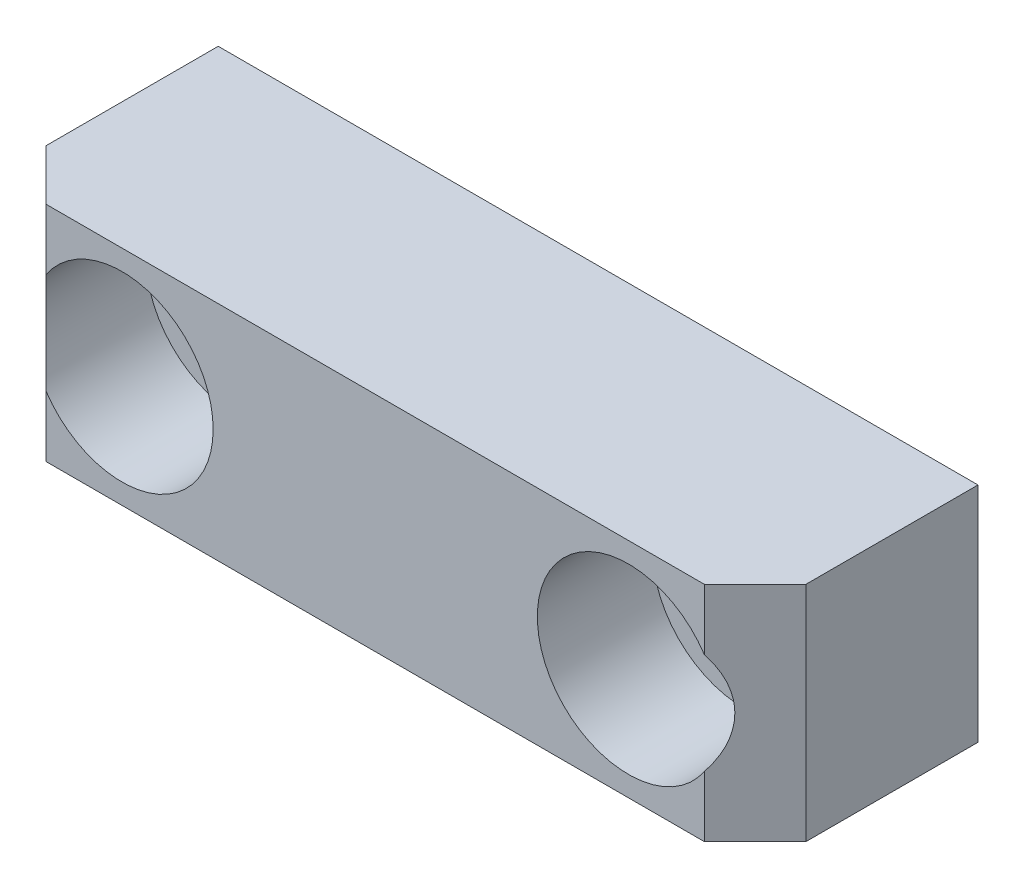
from build123d import *

# Parameters (mm, degrees)
SKETCH1_W                                        = 75
SKETCH1_H                                        = 22
BOSS_EXTRUDE1_DEPTH                              = 22
CBORE_FOR_M10_SOCKET_HEAD_CAP_SCREW1_D           = 12
CBORE_FOR_M10_SOCKET_HEAD_CAP_SCREW1_CBORE_D     = 18
CBORE_FOR_M10_SOCKET_HEAD_CAP_SCREW1_CBORE_DEPTH = 11.366
CHAMFER1_SIZE                                    = 5


with BuildPart() as part:
    # Sketch1 → Boss-Extrude1 (new body)
    with BuildSketch(Plane(origin=(0, 0, 0), x_dir=(1, 0, 0), z_dir=(0, 1, 0))):
        with Locations((0, 11)):
            Rectangle(SKETCH1_W, SKETCH1_H)
    extrude(amount=BOSS_EXTRUDE1_DEPTH)

    # CBORE for M10 Socket Head Cap Screw1 (through all)
    with Locations(Plane.XY):
        with Locations((25, 11), (-25, 11)):
            CounterBoreHole(CBORE_FOR_M10_SOCKET_HEAD_CAP_SCREW1_D / 2, CBORE_FOR_M10_SOCKET_HEAD_CAP_SCREW1_CBORE_D / 2, CBORE_FOR_M10_SOCKET_HEAD_CAP_SCREW1_CBORE_DEPTH)

    # Chamfer1
    # the kernel refuses this chamfer: 5 mm, written as the material it takes off along each edge
    with BuildSketch(Plane(origin=(37.5, -12.85841494, 0), x_dir=(-0.9996219169112968, 0, 0.027495876610586372), z_dir=(0, 1, 0))) as chamfer1_piece_1:
        Polygon((CHAMFER1_SIZE * 0.999621916911, -CHAMFER1_SIZE * 0.0274958766106), (-CHAMFER1_SIZE * 0.0274958766106, -CHAMFER1_SIZE * 0.999621916911), (0, 0), align=None)
    extrude(amount=47.71682988, mode=Mode.SUBTRACT)
    with BuildSketch(Plane(origin=(-37.5, -12.85841494, 0), x_dir=(0.9996219169112968, 0, 0.027495876610586372), z_dir=(0, 1, 0))) as chamfer1_piece_2:
        Polygon((CHAMFER1_SIZE * 0.999621916911, CHAMFER1_SIZE * 0.0274958766106), (-CHAMFER1_SIZE * 0.0274958766106, CHAMFER1_SIZE * 0.999621916911), (0, 0), align=None)
    extrude(amount=47.71682988, mode=Mode.SUBTRACT)


solid = part.part
